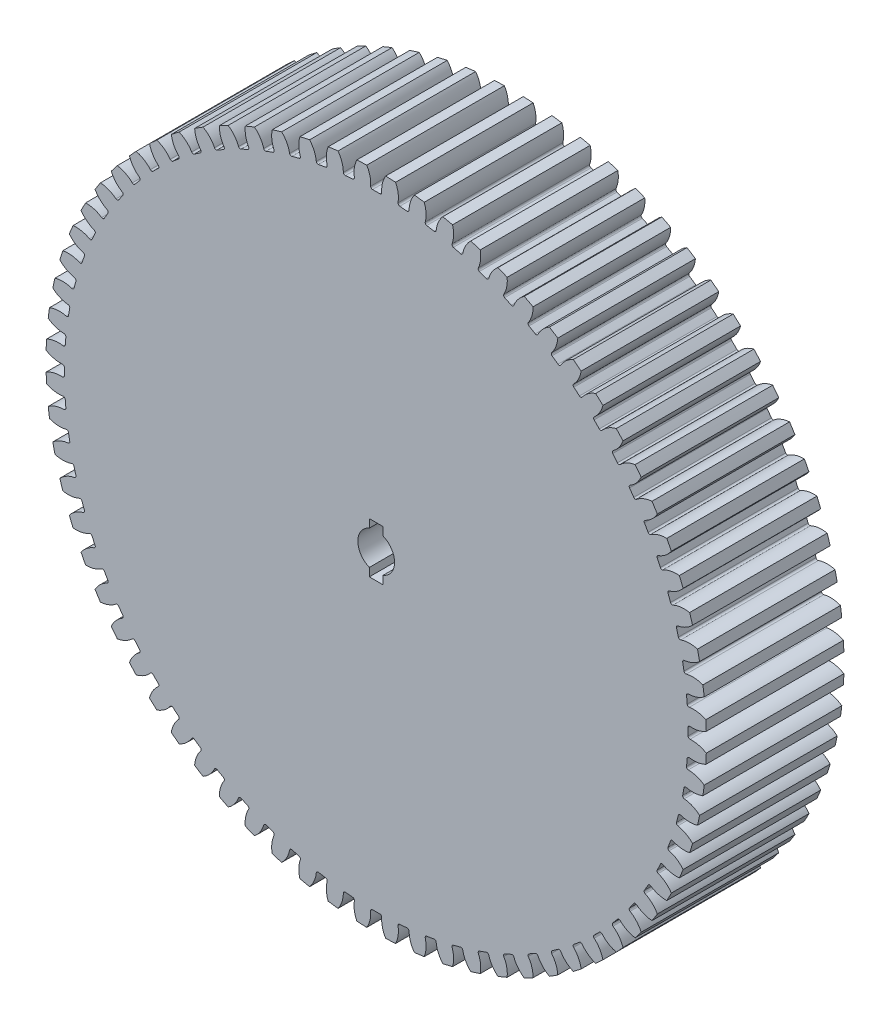
from build123d import *

# Parameters (mm, degrees)
SKETCH1_R           = 36
BOSS_EXTRUDE1_DEPTH = 7.5
SKETCH1_3_R         = 12
SKETCH1_3_R_2       = 4
CUT_EXTRUDE1_DEPTH  = 11
CUT_EXTRUDE2_DEPTH  = 52.461150395
CIRPATTERN1_START   = -7.5
CIRPATTERN1_DEPTH   = 15


# Read off the part's stored shape, not the designer's step: CirPattern1
with BuildPart() as part:
    # Sketch1 → Boss-Extrude1 (new, symmetric)
    with BuildSketch(Plane.XY):
        Circle(SKETCH1_R)
        with BuildLine():
            Line((0.75, -1.854049622), (0.75, -2.75))
            Line((0.75, -2.75), (-0.75, -2.75))
            Line((-0.75, -2.75), (-0.75, -1.854049622))
            ThreePointArc((-0.75, -1.854049622), (-2, 0), (-0.75, 1.854049622))
            Line((-0.75, 1.854049622), (-0.75, 2.75))
            Line((-0.75, 2.75), (0.75, 2.75))
            Line((0.75, 2.75), (0.75, 1.854049622))
            ThreePointArc((0.75, 1.854049622), (2, 0), (0.75, -1.854049622))
        make_face(mode=Mode.SUBTRACT)
    extrude(amount=BOSS_EXTRUDE1_DEPTH, both=True)

    # Sketch1<3> → Cut-Extrude1 (cut)
    with BuildSketch(Plane.XY):
        Circle(SKETCH1_3_R)
        Circle(SKETCH1_3_R_2, mode=Mode.SUBTRACT)
    extrude(amount=-CUT_EXTRUDE1_DEPTH, mode=Mode.SUBTRACT)

    # Sketch2 → Cut-Extrude2 (cut, symmetric)
    with BuildSketch(Plane.XY):
        with BuildLine():
            ThreePointArc((-0.4, 33.997646977), (0, 34), (0.4, 33.997646977))
            ThreePointArc((0.4, 33.997646977), (0.548013734, 34.060582294), (0.601825285, 34.212151541))
            ThreePointArc((0.601825285, 34.212151541), (1.569426683, 36.64385298), (4.077755677, 37.39065283))
            ThreePointArc((4.077755677, 37.39065283), (0, 38.661534345), (-4.077755677, 37.39065283))
            ThreePointArc((-4.077755677, 37.39065283), (-1.569426683, 36.64385298), (-0.601825285, 34.212151541))
            ThreePointArc((-0.601825285, 34.212151541), (-0.548013734, 34.060582294), (-0.4, 33.997646977))
        make_face()
    extrude(amount=CUT_EXTRUDE2_DEPTH, both=True, mode=Mode.SUBTRACT)

    # CirPattern1 outline → CirPattern1 (cut)
    with BuildSketch(Plane.XY.offset(CIRPATTERN1_START)):
        with BuildLine():
            ThreePointArc((3.581320637, 34.029511446), (3.736578294, 34.93923406), (4.161013155, 35.75871879))
            ThreePointArc((4.161013155, 35.75871879), (3.137606739, 35.863009132), (2.111638338, 35.938015855))
            ThreePointArc((2.111638338, 35.938015855), (2.38732305, 35.057278598), (2.382250321, 34.134416505))
            ThreePointArc((2.382250321, 34.134416505), (2.422646972, 33.978734039), (2.564612295, 33.903137964))
            ThreePointArc((2.564612295, 33.903137964), (2.963295253, 33.870619735), (3.361568053, 33.833413369))
            ThreePointArc((3.361568053, 33.833413369), (3.514503725, 33.883208951), (3.581320637, 34.029511446))
        make_face()
        with BuildLine():
            ThreePointArc((6.533559976, 33.587886221), (6.767514381, 34.480615469), (7.26175694, 35.259989877))
            ThreePointArc((7.26175694, 35.259989877), (6.251334396, 35.453079109), (5.235807381, 35.617219447))
            ThreePointArc((5.235807381, 35.617219447), (5.43368172, 34.715806155), (5.348195563, 33.796897949))
            ThreePointArc((5.348195563, 33.796897949), (5.374869871, 33.638287102), (5.509706341, 33.550605599))
            ThreePointArc((5.509706341, 33.550605599), (5.904038041, 33.483463602), (6.297552544, 33.411687056))
            ThreePointArc((6.297552544, 33.411687056), (6.45424622, 33.447963929), (6.533559976, 33.587886221))
        make_face()
        with BuildLine():
            ThreePointArc((9.436074978, 32.890636901), (9.746945597, 33.759578575), (10.307234369, 34.492911151))
            ThreePointArc((10.307234369, 34.492911151), (9.317485624, 34.773329747), (8.320128769, 35.025354492))
            ThreePointArc((8.320128769, 35.025354492), (8.438686791, 34.110125466), (8.273437807, 33.202164592))
            ThreePointArc((8.273437807, 33.202164592), (8.286186766, 33.041832488), (8.412868196, 32.942732867))
            ThreePointArc((8.412868196, 32.942732867), (8.799847534, 32.841478094), (9.185608857, 32.73567763))
            ThreePointArc((9.185608857, 32.73567763), (9.344868004, 32.758159705), (9.436074978, 32.890636901))
        make_face()
        with BuildLine():
            ThreePointArc((12.266775753, 31.943069974), (12.652196672, 32.781610903), (13.274267522, 33.463320543))
            ThreePointArc((13.274267522, 33.463320543), (12.31272516, 33.828934349), (11.341128952, 34.166925441))
            ThreePointArc((11.341128952, 34.166925441), (11.37946836, 33.244846125), (11.135714194, 32.354742715))
            ThreePointArc((11.135714194, 32.354742715), (11.134440776, 32.193909577), (11.252003044, 32.084146046))
            ThreePointArc((11.252003044, 32.084146046), (11.628684873, 31.949549107), (12.00375714, 31.810529931))
            ThreePointArc((12.00375714, 31.810529931), (12.1643697, 31.819046105), (12.266775753, 31.943069974))
        make_face()
        with BuildLine():
            ThreePointArc((15.004118957, 30.752396997), (15.461156891, 31.554155378), (16.140275483, 32.17905386))
            ThreePointArc((16.140275483, 32.17905386), (15.214257423, 32.627080334), (14.275816297, 33.048465457))
            ThreePointArc((14.275816297, 33.048465457), (14.233645304, 32.126553432), (13.913241073, 31.261081709))
            ThreePointArc((13.913241073, 31.261081709), (13.897954968, 31.100971576), (14.005503354, 30.981379501))
            ThreePointArc((14.005503354, 30.981379501), (14.369020899, 30.814464759), (14.730549584, 30.643284892))
            ThreePointArc((14.730549584, 30.643284892), (14.891293198, 30.637770352), (15.004118957, 30.752396997))
        make_face()
        with BuildLine():
            ThreePointArc((17.627271756, 29.32767971), (18.15244837, 30.086553678), (18.883446202, 30.649885147))
            ThreePointArc((18.883446202, 30.649885147), (18.000000001, 31.176914536), (17.10185606, 31.678486696))
            ThreePointArc((17.10185606, 31.678486696), (16.979495613, 30.763758268), (16.584879785, 29.929504995))
            ThreePointArc((16.584879785, 29.929504995), (16.555697331, 29.771336401), (16.652413327, 29.642825951))
            ThreePointArc((16.652413327, 29.642825951), (17, 29.444863729), (17.34523365, 29.242825951))
            ThreePointArc((17.34523365, 29.242825951), (17.504884963, 29.223322667), (17.627271756, 29.32767971))
        make_face()
        with BuildLine():
            ThreePointArc((20.116270373, 27.679761072), (20.705588755, 28.389975138), (21.482902493, 28.887452301))
            ThreePointArc((21.482902493, 28.887452301), (20.648751709, 29.489473595), (19.797740371, 30.067415523))
            ThreePointArc((19.797740371, 30.067415523), (19.596121708, 29.166832328), (19.130297548, 28.370146677))
            ThreePointArc((19.130297548, 28.370146677), (19.087440841, 28.215123381), (19.17258838, 28.078672597))
            ThreePointArc((19.17258838, 28.078672597), (19.501598836, 27.851169506), (19.827910015, 27.619811448))
            ThreePointArc((19.827910015, 27.619811448), (19.985253983, 27.586467851), (20.116270373, 27.679761072))
        make_face()
        with BuildLine():
            ThreePointArc((22.452172027, 25.821182739), (23.101147109, 26.477331744), (23.918860925, 26.905168501))
            ThreePointArc((23.918860925, 26.905168501), (23.140353949, 27.577599953), (22.342951924, 28.227513162))
            ThreePointArc((22.342951924, 28.227513162), (22.063609483, 27.347929183), (21.530122196, 26.594874412))
            ThreePointArc((21.530122196, 26.594874412), (21.473917401, 26.444176234), (21.546848458, 26.30082359))
            ThreePointArc((21.546848458, 26.30082359), (21.854778729, 26.045511066), (22.159684013, 25.786593502))
            ThreePointArc((22.159684013, 25.786593502), (22.313523154, 25.739663357), (22.452172027, 25.821182739))
        make_face()
        with BuildLine():
            ThreePointArc((24.617199094, 23.766089614), (25.320891784, 24.363179869), (26.172782382, 24.718120122))
            ThreePointArc((26.172782382, 24.718120122), (25.455844123, 25.455844123), (24.718120122, 26.172782382))
            ThreePointArc((24.718120122, 26.172782382), (24.363179869, 25.320891784), (23.766089614, 24.617199094))
            ThreePointArc((23.766089614, 24.617199094), (23.696964483, 24.471972939), (23.75712401, 24.322809435))
            ThreePointArc((23.75712401, 24.322809435), (24.04163056, 24.04163056), (24.322809435, 23.75712401))
            ThreePointArc((24.322809435, 23.75712401), (24.471972939, 23.696964483), (24.617199094, 23.766089614))
        make_face()
        with BuildLine():
            ThreePointArc((26.594874412, 21.530122196), (27.347929183, 22.063609483), (28.227513162, 22.342951924))
            ThreePointArc((28.227513162, 22.342951924), (27.577599953, 23.140353949), (26.905168501, 23.918860925))
            ThreePointArc((26.905168501, 23.918860925), (26.477331744, 23.101147109), (25.821182739, 22.452172027))
            ThreePointArc((25.821182739, 22.452172027), (25.739663357, 22.313523154), (25.786593502, 22.159684013))
            ThreePointArc((25.786593502, 22.159684013), (26.045511066, 21.854778729), (26.30082359, 21.546848458))
            ThreePointArc((26.30082359, 21.546848458), (26.444176234, 21.473917401), (26.594874412, 21.530122196))
        make_face()
        with BuildLine():
            ThreePointArc((28.370146677, 19.130297548), (29.166832328, 19.596121708), (30.067415522, 19.797740371))
            ThreePointArc((30.067415522, 19.797740371), (29.489473595, 20.648751709), (28.887452302, 21.482902493))
            ThreePointArc((28.887452302, 21.482902493), (28.389975138, 20.705588755), (27.679761072, 20.116270373))
            ThreePointArc((27.679761072, 20.116270373), (27.586467851, 19.985253983), (27.619811448, 19.827910015))
            ThreePointArc((27.619811448, 19.827910015), (27.851169506, 19.501598836), (28.078672597, 19.17258838))
            ThreePointArc((28.078672597, 19.17258838), (28.215123381, 19.087440841), (28.370146677, 19.130297548))
        make_face()
        with BuildLine():
            ThreePointArc((29.929504995, 16.584879785), (30.763758268, 16.979495613), (31.678486695, 17.10185606))
            ThreePointArc((31.678486695, 17.10185606), (31.176914536, 18), (30.649885147, 18.883446202))
            ThreePointArc((30.649885147, 18.883446202), (30.086553678, 18.15244837), (29.32767971, 17.627271756))
            ThreePointArc((29.32767971, 17.627271756), (29.223322667, 17.504884963), (29.242825951, 17.34523365))
            ThreePointArc((29.242825951, 17.34523365), (29.444863729, 17), (29.642825951, 16.652413327))
            ThreePointArc((29.642825951, 16.652413327), (29.771336401, 16.555697331), (29.929504995, 16.584879785))
        make_face()
        with BuildLine():
            ThreePointArc((31.261081709, 13.913241073), (32.126553432, 14.233645304), (33.048465457, 14.275816297))
            ThreePointArc((33.048465457, 14.275816297), (32.627080334, 15.214257423), (32.17905386, 16.140275483))
            ThreePointArc((32.17905386, 16.140275483), (31.554155378, 15.461156891), (30.752396997, 15.004118957))
            ThreePointArc((30.752396997, 15.004118957), (30.637770352, 14.891293198), (30.643284892, 14.730549584))
            ThreePointArc((30.643284892, 14.730549584), (30.814464759, 14.369020899), (30.981379501, 14.005503354))
            ThreePointArc((30.981379501, 14.005503354), (31.100971576, 13.897954968), (31.261081709, 13.913241073))
        make_face()
        with BuildLine():
            ThreePointArc((32.354742715, 11.135714194), (33.244846125, 11.37946836), (34.166925441, 11.341128952))
            ThreePointArc((34.166925441, 11.341128952), (33.828934349, 12.31272516), (33.463320543, 13.274267522))
            ThreePointArc((33.463320543, 13.274267522), (32.781610903, 12.652196672), (31.943069974, 12.266775753))
            ThreePointArc((31.943069974, 12.266775753), (31.819046105, 12.1643697), (31.810529931, 12.00375714))
            ThreePointArc((31.810529931, 12.00375714), (31.949549107, 11.628684873), (32.084146046, 11.252003044))
            ThreePointArc((32.084146046, 11.252003044), (32.193909577, 11.134440776), (32.354742715, 11.135714194))
        make_face()
        with BuildLine():
            ThreePointArc((33.202164592, 8.273437807), (34.110125466, 8.438686791), (35.025354492, 8.320128769))
            ThreePointArc((35.025354492, 8.320128769), (34.773329747, 9.317485624), (34.492911151, 10.307234369))
            ThreePointArc((34.492911151, 10.307234369), (33.759578575, 9.746945597), (32.890636901, 9.436074978))
            ThreePointArc((32.890636901, 9.436074978), (32.758159705, 9.344868004), (32.73567763, 9.185608857))
            ThreePointArc((32.73567763, 9.185608857), (32.841478094, 8.799847534), (32.942732867, 8.412868196))
            ThreePointArc((32.942732867, 8.412868196), (33.041832488, 8.286186766), (33.202164592, 8.273437807))
        make_face()
        with BuildLine():
            ThreePointArc((33.796897949, 5.348195563), (34.715806155, 5.43368172), (35.617219446, 5.235807381))
            ThreePointArc((35.617219446, 5.235807381), (35.453079109, 6.251334396), (35.259989878, 7.26175694))
            ThreePointArc((35.259989878, 7.26175694), (34.480615469, 6.767514381), (33.587886221, 6.533559976))
            ThreePointArc((33.587886221, 6.533559976), (33.447963929, 6.45424622), (33.411687056, 6.297552544))
            ThreePointArc((33.411687056, 6.297552544), (33.483463602, 5.904038041), (33.550605599, 5.509706341))
            ThreePointArc((33.550605599, 5.509706341), (33.638287102, 5.374869871), (33.796897949, 5.348195563))
        make_face()
        with BuildLine():
            ThreePointArc((34.134416505, 2.382250321), (35.057278598, 2.38732305), (35.938015854, 2.111638338))
            ThreePointArc((35.938015854, 2.111638338), (35.863009132, 3.137606739), (35.758718791, 4.161013155))
            ThreePointArc((35.758718791, 4.161013155), (34.93923406, 3.736578294), (34.029511446, 3.581320637))
            ThreePointArc((34.029511446, 3.581320637), (33.883208951, 3.514503725), (33.833413369, 3.361568053))
            ThreePointArc((33.833413369, 3.361568053), (33.870619735, 2.963295253), (33.903137964, 2.564612295))
            ThreePointArc((33.903137964, 2.564612295), (33.978734039, 2.422646972), (34.134416505, 2.382250321))
        make_face()
        with BuildLine():
            ThreePointArc((34.212151541, -0.601825285), (35.131943983, -0.67720459), (35.985302262, -1.028601548))
            ThreePointArc((35.985302262, -1.028601548), (36, 0), (35.985302262, 1.028601548))
            ThreePointArc((35.985302262, 1.028601548), (35.131943983, 0.67720459), (34.212151541, 0.601825285))
            ThreePointArc((34.212151541, 0.601825285), (34.060582294, 0.548013734), (33.997646977, 0.4))
            ThreePointArc((33.997646977, 0.4), (34, 0), (33.997646977, -0.4))
            ThreePointArc((33.997646977, -0.4), (34.060582294, -0.548013734), (34.212151541, -0.601825285))
        make_face()
        with BuildLine():
            ThreePointArc((34.029511446, -3.581320637), (34.93923406, -3.736578294), (35.75871879, -4.161013155))
            ThreePointArc((35.75871879, -4.161013155), (35.863009132, -3.137606739), (35.938015854, -2.111638338))
            ThreePointArc((35.938015854, -2.111638338), (35.057278598, -2.38732305), (34.134416505, -2.382250321))
            ThreePointArc((34.134416505, -2.382250321), (33.978734039, -2.422646972), (33.903137964, -2.564612295))
            ThreePointArc((33.903137964, -2.564612295), (33.870619735, -2.963295253), (33.833413369, -3.361568053))
            ThreePointArc((33.833413369, -3.361568053), (33.883208951, -3.514503725), (34.029511446, -3.581320637))
        make_face()
        with BuildLine():
            ThreePointArc((33.587886221, -6.533559976), (34.480615469, -6.767514381), (35.259989877, -7.26175694))
            ThreePointArc((35.259989877, -7.26175694), (35.453079109, -6.251334396), (35.617219446, -5.235807381))
            ThreePointArc((35.617219446, -5.235807381), (34.715806155, -5.43368172), (33.796897949, -5.348195563))
            ThreePointArc((33.796897949, -5.348195563), (33.638287102, -5.374869871), (33.550605599, -5.509706341))
            ThreePointArc((33.550605599, -5.509706341), (33.483463602, -5.904038041), (33.411687056, -6.297552544))
            ThreePointArc((33.411687056, -6.297552544), (33.447963929, -6.45424622), (33.587886221, -6.533559976))
        make_face()
        with BuildLine():
            ThreePointArc((32.890636901, -9.436074978), (33.759578575, -9.746945597), (34.492911151, -10.307234369))
            ThreePointArc((34.492911151, -10.307234369), (34.773329747, -9.317485624), (35.025354492, -8.320128769))
            ThreePointArc((35.025354492, -8.320128769), (34.110125466, -8.438686791), (33.202164592, -8.273437807))
            ThreePointArc((33.202164592, -8.273437807), (33.041832488, -8.286186766), (32.942732867, -8.412868196))
            ThreePointArc((32.942732867, -8.412868196), (32.841478094, -8.799847534), (32.73567763, -9.185608857))
            ThreePointArc((32.73567763, -9.185608857), (32.758159705, -9.344868004), (32.890636901, -9.436074978))
        make_face()
        with BuildLine():
            ThreePointArc((31.943069974, -12.266775753), (32.781610903, -12.652196672), (33.463320543, -13.274267522))
            ThreePointArc((33.463320543, -13.274267522), (33.828934348, -12.31272516), (34.166925441, -11.341128952))
            ThreePointArc((34.166925441, -11.341128952), (33.244846125, -11.37946836), (32.354742715, -11.135714194))
            ThreePointArc((32.354742715, -11.135714194), (32.193909577, -11.134440776), (32.084146046, -11.252003044))
            ThreePointArc((32.084146046, -11.252003044), (31.949549107, -11.628684873), (31.810529931, -12.00375714))
            ThreePointArc((31.810529931, -12.00375714), (31.819046105, -12.1643697), (31.943069974, -12.266775753))
        make_face()
        with BuildLine():
            ThreePointArc((30.752396997, -15.004118957), (31.554155378, -15.461156891), (32.17905386, -16.140275483))
            ThreePointArc((32.17905386, -16.140275483), (32.627080333, -15.214257423), (33.048465457, -14.275816297))
            ThreePointArc((33.048465457, -14.275816297), (32.126553432, -14.233645304), (31.261081709, -13.913241073))
            ThreePointArc((31.261081709, -13.913241073), (31.100971576, -13.897954968), (30.981379501, -14.005503354))
            ThreePointArc((30.981379501, -14.005503354), (30.814464759, -14.369020899), (30.643284892, -14.730549584))
            ThreePointArc((30.643284892, -14.730549584), (30.637770352, -14.891293198), (30.752396997, -15.004118957))
        make_face()
        with BuildLine():
            ThreePointArc((29.32767971, -17.627271756), (30.086553678, -18.15244837), (30.649885147, -18.883446202))
            ThreePointArc((30.649885147, -18.883446202), (31.176914536, -18), (31.678486695, -17.10185606))
            ThreePointArc((31.678486695, -17.10185606), (30.763758268, -16.979495613), (29.929504995, -16.584879785))
            ThreePointArc((29.929504995, -16.584879785), (29.771336401, -16.555697331), (29.642825951, -16.652413327))
            ThreePointArc((29.642825951, -16.652413327), (29.444863729, -17), (29.242825951, -17.34523365))
            ThreePointArc((29.242825951, -17.34523365), (29.223322667, -17.504884963), (29.32767971, -17.627271756))
        make_face()
        with BuildLine():
            ThreePointArc((27.679761072, -20.116270373), (28.389975138, -20.705588755), (28.887452301, -21.482902493))
            ThreePointArc((28.887452301, -21.482902493), (29.489473594, -20.648751709), (30.067415522, -19.797740371))
            ThreePointArc((30.067415522, -19.797740371), (29.166832328, -19.596121708), (28.370146677, -19.130297548))
            ThreePointArc((28.370146677, -19.130297548), (28.215123381, -19.087440841), (28.078672597, -19.17258838))
            ThreePointArc((28.078672597, -19.17258838), (27.851169506, -19.501598836), (27.619811448, -19.827910015))
            ThreePointArc((27.619811448, -19.827910015), (27.586467851, -19.985253983), (27.679761072, -20.116270373))
        make_face()
        with BuildLine():
            ThreePointArc((25.821182739, -22.452172027), (26.477331744, -23.101147109), (26.905168501, -23.918860925))
            ThreePointArc((26.905168501, -23.918860925), (27.577599952, -23.140353949), (28.227513162, -22.342951924))
            ThreePointArc((28.227513162, -22.342951924), (27.347929183, -22.063609483), (26.594874412, -21.530122196))
            ThreePointArc((26.594874412, -21.530122196), (26.444176234, -21.473917401), (26.30082359, -21.546848458))
            ThreePointArc((26.30082359, -21.546848458), (26.045511066, -21.854778729), (25.786593502, -22.159684013))
            ThreePointArc((25.786593502, -22.159684013), (25.739663357, -22.313523154), (25.821182739, -22.452172027))
        make_face()
        with BuildLine():
            ThreePointArc((23.766089614, -24.617199094), (24.363179869, -25.320891784), (24.718120122, -26.172782382))
            ThreePointArc((24.718120122, -26.172782382), (25.455844123, -25.455844123), (26.172782382, -24.718120122))
            ThreePointArc((26.172782382, -24.718120122), (25.320891784, -24.363179869), (24.617199094, -23.766089614))
            ThreePointArc((24.617199094, -23.766089614), (24.471972939, -23.696964483), (24.322809435, -23.75712401))
            ThreePointArc((24.322809435, -23.75712401), (24.04163056, -24.04163056), (23.75712401, -24.322809435))
            ThreePointArc((23.75712401, -24.322809435), (23.696964483, -24.471972939), (23.766089614, -24.617199094))
        make_face()
        with BuildLine():
            ThreePointArc((21.530122196, -26.594874412), (22.063609483, -27.347929183), (22.342951924, -28.227513162))
            ThreePointArc((22.342951924, -28.227513162), (23.140353949, -27.577599952), (23.918860925, -26.905168501))
            ThreePointArc((23.918860925, -26.905168501), (23.101147109, -26.477331744), (22.452172027, -25.821182739))
            ThreePointArc((22.452172027, -25.821182739), (22.313523154, -25.739663357), (22.159684013, -25.786593502))
            ThreePointArc((22.159684013, -25.786593502), (21.854778729, -26.045511066), (21.546848458, -26.30082359))
            ThreePointArc((21.546848458, -26.30082359), (21.473917401, -26.444176234), (21.530122196, -26.594874412))
        make_face()
        with BuildLine():
            ThreePointArc((19.130297548, -28.370146677), (19.596121707, -29.166832328), (19.797740371, -30.067415522))
            ThreePointArc((19.797740371, -30.067415522), (20.648751709, -29.489473594), (21.482902493, -28.887452301))
            ThreePointArc((21.482902493, -28.887452301), (20.705588755, -28.389975138), (20.116270373, -27.679761072))
            ThreePointArc((20.116270373, -27.679761072), (19.985253983, -27.586467851), (19.827910015, -27.619811448))
            ThreePointArc((19.827910015, -27.619811448), (19.501598836, -27.851169506), (19.17258838, -28.078672597))
            ThreePointArc((19.17258838, -28.078672597), (19.087440841, -28.215123381), (19.130297548, -28.370146677))
        make_face()
        with BuildLine():
            ThreePointArc((16.584879785, -29.929504995), (16.979495613, -30.763758268), (17.10185606, -31.678486695))
            ThreePointArc((17.10185606, -31.678486695), (18, -31.176914536), (18.883446202, -30.649885147))
            ThreePointArc((18.883446202, -30.649885147), (18.15244837, -30.086553678), (17.627271756, -29.32767971))
            ThreePointArc((17.627271756, -29.32767971), (17.504884963, -29.223322667), (17.34523365, -29.242825951))
            ThreePointArc((17.34523365, -29.242825951), (17, -29.444863729), (16.652413327, -29.642825951))
            ThreePointArc((16.652413327, -29.642825951), (16.555697331, -29.771336401), (16.584879785, -29.929504995))
        make_face()
        with BuildLine():
            ThreePointArc((13.913241073, -31.261081709), (14.233645304, -32.126553432), (14.275816297, -33.048465457))
            ThreePointArc((14.275816297, -33.048465457), (15.214257423, -32.627080333), (16.140275483, -32.17905386))
            ThreePointArc((16.140275483, -32.17905386), (15.461156891, -31.554155378), (15.004118957, -30.752396997))
            ThreePointArc((15.004118957, -30.752396997), (14.891293198, -30.637770352), (14.730549584, -30.643284892))
            ThreePointArc((14.730549584, -30.643284892), (14.369020899, -30.814464759), (14.005503354, -30.981379501))
            ThreePointArc((14.005503354, -30.981379501), (13.897954968, -31.100971576), (13.913241073, -31.261081709))
        make_face()
        with BuildLine():
            ThreePointArc((11.135714194, -32.354742715), (11.37946836, -33.244846125), (11.341128952, -34.166925441))
            ThreePointArc((11.341128952, -34.166925441), (12.31272516, -33.828934348), (13.274267522, -33.463320543))
            ThreePointArc((13.274267522, -33.463320543), (12.652196672, -32.781610903), (12.266775753, -31.943069974))
            ThreePointArc((12.266775753, -31.943069974), (12.1643697, -31.819046105), (12.00375714, -31.810529931))
            ThreePointArc((12.00375714, -31.810529931), (11.628684873, -31.949549107), (11.252003044, -32.084146046))
            ThreePointArc((11.252003044, -32.084146046), (11.134440776, -32.193909577), (11.135714194, -32.354742715))
        make_face()
        with BuildLine():
            ThreePointArc((-2.111638338, 35.938015855), (-3.137606739, 35.863009132), (-4.161013155, 35.758718791))
            ThreePointArc((-4.161013155, 35.758718791), (-3.736578294, 34.93923406), (-3.581320637, 34.029511446))
            ThreePointArc((-3.581320637, 34.029511446), (-3.514503725, 33.883208951), (-3.361568053, 33.833413369))
            ThreePointArc((-3.361568053, 33.833413369), (-2.963295253, 33.870619735), (-2.564612295, 33.903137964))
            ThreePointArc((-2.564612295, 33.903137964), (-2.422646972, 33.978734039), (-2.382250321, 34.134416505))
            ThreePointArc((-2.382250321, 34.134416505), (-2.38732305, 35.057278598), (-2.111638338, 35.938015855))
        make_face()
        with BuildLine():
            ThreePointArc((-5.235807381, 35.617219447), (-6.251334396, 35.453079109), (-7.26175694, 35.259989878))
            ThreePointArc((-7.26175694, 35.259989878), (-6.767514381, 34.480615469), (-6.533559976, 33.587886221))
            ThreePointArc((-6.533559976, 33.587886221), (-6.45424622, 33.447963929), (-6.297552544, 33.411687056))
            ThreePointArc((-6.297552544, 33.411687056), (-5.904038041, 33.483463602), (-5.509706341, 33.550605599))
            ThreePointArc((-5.509706341, 33.550605599), (-5.374869871, 33.638287102), (-5.348195563, 33.796897949))
            ThreePointArc((-5.348195563, 33.796897949), (-5.43368172, 34.715806155), (-5.235807381, 35.617219447))
        make_face()
        with BuildLine():
            ThreePointArc((-8.320128769, 35.025354492), (-9.317485624, 34.773329747), (-10.307234369, 34.492911151))
            ThreePointArc((-10.307234369, 34.492911151), (-9.746945597, 33.759578575), (-9.436074978, 32.890636901))
            ThreePointArc((-9.436074978, 32.890636901), (-9.344868004, 32.758159705), (-9.185608857, 32.73567763))
            ThreePointArc((-9.185608857, 32.73567763), (-8.799847534, 32.841478094), (-8.412868196, 32.942732867))
            ThreePointArc((-8.412868196, 32.942732867), (-8.286186766, 33.041832488), (-8.273437807, 33.202164592))
            ThreePointArc((-8.273437807, 33.202164592), (-8.438686791, 34.110125466), (-8.320128769, 35.025354492))
        make_face()
        with BuildLine():
            ThreePointArc((-11.341128952, 34.166925441), (-12.31272516, 33.828934349), (-13.274267522, 33.463320543))
            ThreePointArc((-13.274267522, 33.463320543), (-12.652196672, 32.781610903), (-12.266775753, 31.943069974))
            ThreePointArc((-12.266775753, 31.943069974), (-12.1643697, 31.819046105), (-12.00375714, 31.810529931))
            ThreePointArc((-12.00375714, 31.810529931), (-11.628684873, 31.949549107), (-11.252003044, 32.084146046))
            ThreePointArc((-11.252003044, 32.084146046), (-11.134440776, 32.193909577), (-11.135714194, 32.354742715))
            ThreePointArc((-11.135714194, 32.354742715), (-11.37946836, 33.244846125), (-11.341128952, 34.166925441))
        make_face()
        with BuildLine():
            ThreePointArc((-14.275816297, 33.048465457), (-15.214257423, 32.627080334), (-16.140275483, 32.17905386))
            ThreePointArc((-16.140275483, 32.17905386), (-15.461156891, 31.554155378), (-15.004118957, 30.752396997))
            ThreePointArc((-15.004118957, 30.752396997), (-14.891293198, 30.637770352), (-14.730549584, 30.643284892))
            ThreePointArc((-14.730549584, 30.643284892), (-14.369020899, 30.814464759), (-14.005503354, 30.981379501))
            ThreePointArc((-14.005503354, 30.981379501), (-13.897954968, 31.100971576), (-13.913241073, 31.261081709))
            ThreePointArc((-13.913241073, 31.261081709), (-14.233645304, 32.126553432), (-14.275816297, 33.048465457))
        make_face()
        with BuildLine():
            ThreePointArc((-17.10185606, 31.678486696), (-18.000000001, 31.176914536), (-18.883446202, 30.649885147))
            ThreePointArc((-18.883446202, 30.649885147), (-18.15244837, 30.086553678), (-17.627271756, 29.32767971))
            ThreePointArc((-17.627271756, 29.32767971), (-17.504884963, 29.223322667), (-17.34523365, 29.242825951))
            ThreePointArc((-17.34523365, 29.242825951), (-17, 29.444863729), (-16.652413327, 29.642825951))
            ThreePointArc((-16.652413327, 29.642825951), (-16.555697331, 29.771336401), (-16.584879785, 29.929504995))
            ThreePointArc((-16.584879785, 29.929504995), (-16.979495613, 30.763758268), (-17.10185606, 31.678486696))
        make_face()
        with BuildLine():
            ThreePointArc((-19.797740371, 30.067415523), (-20.648751709, 29.489473595), (-21.482902494, 28.887452302))
            ThreePointArc((-21.482902494, 28.887452302), (-20.705588755, 28.389975138), (-20.116270373, 27.679761072))
            ThreePointArc((-20.116270373, 27.679761072), (-19.985253983, 27.586467851), (-19.827910015, 27.619811448))
            ThreePointArc((-19.827910015, 27.619811448), (-19.501598836, 27.851169506), (-19.17258838, 28.078672597))
            ThreePointArc((-19.17258838, 28.078672597), (-19.087440841, 28.215123381), (-19.130297548, 28.370146677))
            ThreePointArc((-19.130297548, 28.370146677), (-19.596121708, 29.166832328), (-19.797740371, 30.067415523))
        make_face()
        with BuildLine():
            ThreePointArc((-22.342951924, 28.227513162), (-23.140353949, 27.577599953), (-23.918860925, 26.905168501))
            ThreePointArc((-23.918860925, 26.905168501), (-23.101147109, 26.477331744), (-22.452172027, 25.821182739))
            ThreePointArc((-22.452172027, 25.821182739), (-22.313523154, 25.739663357), (-22.159684013, 25.786593502))
            ThreePointArc((-22.159684013, 25.786593502), (-21.854778729, 26.045511066), (-21.546848458, 26.30082359))
            ThreePointArc((-21.546848458, 26.30082359), (-21.473917401, 26.444176234), (-21.530122196, 26.594874412))
            ThreePointArc((-21.530122196, 26.594874412), (-22.063609483, 27.347929183), (-22.342951924, 28.227513162))
        make_face()
        with BuildLine():
            ThreePointArc((-24.718120122, 26.172782382), (-25.455844123, 25.455844123), (-26.172782382, 24.718120122))
            ThreePointArc((-26.172782382, 24.718120122), (-25.320891784, 24.363179869), (-24.617199094, 23.766089614))
            ThreePointArc((-24.617199094, 23.766089614), (-24.471972939, 23.696964483), (-24.322809435, 23.75712401))
            ThreePointArc((-24.322809435, 23.75712401), (-24.04163056, 24.04163056), (-23.75712401, 24.322809435))
            ThreePointArc((-23.75712401, 24.322809435), (-23.696964483, 24.471972939), (-23.766089614, 24.617199094))
            ThreePointArc((-23.766089614, 24.617199094), (-24.363179869, 25.320891784), (-24.718120122, 26.172782382))
        make_face()
        with BuildLine():
            ThreePointArc((-26.905168501, 23.918860925), (-27.577599953, 23.140353949), (-28.227513162, 22.342951924))
            ThreePointArc((-28.227513162, 22.342951924), (-27.347929183, 22.063609483), (-26.594874412, 21.530122196))
            ThreePointArc((-26.594874412, 21.530122196), (-26.444176234, 21.473917401), (-26.30082359, 21.546848458))
            ThreePointArc((-26.30082359, 21.546848458), (-26.045511066, 21.854778729), (-25.786593502, 22.159684013))
            ThreePointArc((-25.786593502, 22.159684013), (-25.739663357, 22.313523154), (-25.821182739, 22.452172027))
            ThreePointArc((-25.821182739, 22.452172027), (-26.477331744, 23.101147109), (-26.905168501, 23.918860925))
        make_face()
        with BuildLine():
            ThreePointArc((-28.887452302, 21.482902493), (-29.489473595, 20.648751709), (-30.067415523, 19.797740371))
            ThreePointArc((-30.067415523, 19.797740371), (-29.166832328, 19.596121708), (-28.370146677, 19.130297548))
            ThreePointArc((-28.370146677, 19.130297548), (-28.215123381, 19.087440841), (-28.078672597, 19.17258838))
            ThreePointArc((-28.078672597, 19.17258838), (-27.851169506, 19.501598836), (-27.619811448, 19.827910015))
            ThreePointArc((-27.619811448, 19.827910015), (-27.586467851, 19.985253983), (-27.679761072, 20.116270373))
            ThreePointArc((-27.679761072, 20.116270373), (-28.389975138, 20.705588755), (-28.887452302, 21.482902493))
        make_face()
        with BuildLine():
            ThreePointArc((-30.649885147, 18.883446202), (-31.176914536, 18), (-31.678486696, 17.10185606))
            ThreePointArc((-31.678486696, 17.10185606), (-30.763758268, 16.979495613), (-29.929504995, 16.584879785))
            ThreePointArc((-29.929504995, 16.584879785), (-29.771336401, 16.555697331), (-29.642825951, 16.652413327))
            ThreePointArc((-29.642825951, 16.652413327), (-29.444863729, 17), (-29.242825951, 17.34523365))
            ThreePointArc((-29.242825951, 17.34523365), (-29.223322667, 17.504884963), (-29.32767971, 17.627271756))
            ThreePointArc((-29.32767971, 17.627271756), (-30.086553678, 18.15244837), (-30.649885147, 18.883446202))
        make_face()
        with BuildLine():
            ThreePointArc((-32.17905386, 16.140275483), (-32.627080334, 15.214257423), (-33.048465457, 14.275816297))
            ThreePointArc((-33.048465457, 14.275816297), (-32.126553432, 14.233645304), (-31.261081709, 13.913241073))
            ThreePointArc((-31.261081709, 13.913241073), (-31.100971576, 13.897954968), (-30.981379501, 14.005503354))
            ThreePointArc((-30.981379501, 14.005503354), (-30.814464759, 14.369020899), (-30.643284892, 14.730549584))
            ThreePointArc((-30.643284892, 14.730549584), (-30.637770352, 14.891293198), (-30.752396997, 15.004118957))
            ThreePointArc((-30.752396997, 15.004118957), (-31.554155378, 15.461156891), (-32.17905386, 16.140275483))
        make_face()
        with BuildLine():
            ThreePointArc((-33.463320543, 13.274267522), (-33.828934349, 12.31272516), (-34.166925441, 11.341128952))
            ThreePointArc((-34.166925441, 11.341128952), (-33.244846125, 11.37946836), (-32.354742715, 11.135714194))
            ThreePointArc((-32.354742715, 11.135714194), (-32.193909577, 11.134440776), (-32.084146046, 11.252003044))
            ThreePointArc((-32.084146046, 11.252003044), (-31.949549107, 11.628684873), (-31.810529931, 12.00375714))
            ThreePointArc((-31.810529931, 12.00375714), (-31.819046105, 12.1643697), (-31.943069974, 12.266775753))
            ThreePointArc((-31.943069974, 12.266775753), (-32.781610903, 12.652196672), (-33.463320543, 13.274267522))
        make_face()
        with BuildLine():
            ThreePointArc((-34.492911151, 10.307234369), (-34.773329747, 9.317485624), (-35.025354492, 8.320128769))
            ThreePointArc((-35.025354492, 8.320128769), (-34.110125466, 8.438686791), (-33.202164592, 8.273437807))
            ThreePointArc((-33.202164592, 8.273437807), (-33.041832488, 8.286186766), (-32.942732867, 8.412868196))
            ThreePointArc((-32.942732867, 8.412868196), (-32.841478094, 8.799847534), (-32.73567763, 9.185608857))
            ThreePointArc((-32.73567763, 9.185608857), (-32.758159705, 9.344868004), (-32.890636901, 9.436074978))
            ThreePointArc((-32.890636901, 9.436074978), (-33.759578575, 9.746945597), (-34.492911151, 10.307234369))
        make_face()
        with BuildLine():
            ThreePointArc((-35.259989878, 7.26175694), (-35.453079109, 6.251334396), (-35.617219446, 5.235807381))
            ThreePointArc((-35.617219446, 5.235807381), (-34.715806155, 5.43368172), (-33.796897949, 5.348195563))
            ThreePointArc((-33.796897949, 5.348195563), (-33.638287102, 5.374869871), (-33.550605599, 5.509706341))
            ThreePointArc((-33.550605599, 5.509706341), (-33.483463602, 5.904038041), (-33.411687056, 6.297552544))
            ThreePointArc((-33.411687056, 6.297552544), (-33.447963929, 6.45424622), (-33.587886221, 6.533559976))
            ThreePointArc((-33.587886221, 6.533559976), (-34.480615469, 6.767514381), (-35.259989878, 7.26175694))
        make_face()
        with BuildLine():
            ThreePointArc((-35.758718791, 4.161013155), (-35.863009132, 3.137606739), (-35.938015854, 2.111638338))
            ThreePointArc((-35.938015854, 2.111638338), (-35.057278598, 2.38732305), (-34.134416505, 2.382250321))
            ThreePointArc((-34.134416505, 2.382250321), (-33.978734039, 2.422646972), (-33.903137964, 2.564612295))
            ThreePointArc((-33.903137964, 2.564612295), (-33.870619735, 2.963295253), (-33.833413369, 3.361568053))
            ThreePointArc((-33.833413369, 3.361568053), (-33.883208951, 3.514503725), (-34.029511446, 3.581320637))
            ThreePointArc((-34.029511446, 3.581320637), (-34.93923406, 3.736578294), (-35.758718791, 4.161013155))
        make_face()
        with BuildLine():
            ThreePointArc((-35.985302262, 1.028601548), (-36, 0), (-35.985302262, -1.028601548))
            ThreePointArc((-35.985302262, -1.028601548), (-35.131943983, -0.67720459), (-34.212151541, -0.601825285))
            ThreePointArc((-34.212151541, -0.601825285), (-34.060582294, -0.548013734), (-33.997646977, -0.4))
            ThreePointArc((-33.997646977, -0.4), (-34, 0), (-33.997646977, 0.4))
            ThreePointArc((-33.997646977, 0.4), (-34.060582294, 0.548013734), (-34.212151541, 0.601825285))
            ThreePointArc((-34.212151541, 0.601825285), (-35.131943983, 0.67720459), (-35.985302262, 1.028601548))
        make_face()
        with BuildLine():
            ThreePointArc((-35.938015854, -2.111638338), (-35.863009132, -3.137606739), (-35.75871879, -4.161013155))
            ThreePointArc((-35.75871879, -4.161013155), (-34.93923406, -3.736578294), (-34.029511446, -3.581320637))
            ThreePointArc((-34.029511446, -3.581320637), (-33.883208951, -3.514503725), (-33.833413369, -3.361568053))
            ThreePointArc((-33.833413369, -3.361568053), (-33.870619735, -2.963295253), (-33.903137964, -2.564612295))
            ThreePointArc((-33.903137964, -2.564612295), (-33.978734039, -2.422646972), (-34.134416505, -2.382250321))
            ThreePointArc((-34.134416505, -2.382250321), (-35.057278598, -2.38732305), (-35.938015854, -2.111638338))
        make_face()
        with BuildLine():
            ThreePointArc((-35.617219446, -5.235807381), (-35.453079109, -6.251334396), (-35.259989877, -7.26175694))
            ThreePointArc((-35.259989877, -7.26175694), (-34.480615469, -6.767514381), (-33.587886221, -6.533559976))
            ThreePointArc((-33.587886221, -6.533559976), (-33.447963929, -6.45424622), (-33.411687056, -6.297552544))
            ThreePointArc((-33.411687056, -6.297552544), (-33.483463602, -5.904038041), (-33.550605599, -5.509706341))
            ThreePointArc((-33.550605599, -5.509706341), (-33.638287102, -5.374869871), (-33.796897949, -5.348195563))
            ThreePointArc((-33.796897949, -5.348195563), (-34.715806155, -5.43368172), (-35.617219446, -5.235807381))
        make_face()
        with BuildLine():
            ThreePointArc((-35.025354492, -8.320128769), (-34.773329747, -9.317485624), (-34.492911151, -10.307234369))
            ThreePointArc((-34.492911151, -10.307234369), (-33.759578575, -9.746945597), (-32.890636901, -9.436074978))
            ThreePointArc((-32.890636901, -9.436074978), (-32.758159705, -9.344868004), (-32.73567763, -9.185608857))
            ThreePointArc((-32.73567763, -9.185608857), (-32.841478094, -8.799847534), (-32.942732867, -8.412868196))
            ThreePointArc((-32.942732867, -8.412868196), (-33.041832488, -8.286186766), (-33.202164592, -8.273437807))
            ThreePointArc((-33.202164592, -8.273437807), (-34.110125466, -8.438686791), (-35.025354492, -8.320128769))
        make_face()
        with BuildLine():
            ThreePointArc((-34.166925441, -11.341128952), (-33.828934348, -12.31272516), (-33.463320543, -13.274267522))
            ThreePointArc((-33.463320543, -13.274267522), (-32.781610903, -12.652196672), (-31.943069974, -12.266775753))
            ThreePointArc((-31.943069974, -12.266775753), (-31.819046105, -12.1643697), (-31.810529931, -12.00375714))
            ThreePointArc((-31.810529931, -12.00375714), (-31.949549107, -11.628684873), (-32.084146046, -11.252003044))
            ThreePointArc((-32.084146046, -11.252003044), (-32.193909577, -11.134440776), (-32.354742715, -11.135714194))
            ThreePointArc((-32.354742715, -11.135714194), (-33.244846125, -11.37946836), (-34.166925441, -11.341128952))
        make_face()
        with BuildLine():
            ThreePointArc((-33.048465457, -14.275816297), (-32.627080333, -15.214257423), (-32.17905386, -16.140275483))
            ThreePointArc((-32.17905386, -16.140275483), (-31.554155378, -15.461156891), (-30.752396997, -15.004118957))
            ThreePointArc((-30.752396997, -15.004118957), (-30.637770352, -14.891293198), (-30.643284892, -14.730549584))
            ThreePointArc((-30.643284892, -14.730549584), (-30.814464759, -14.369020899), (-30.981379501, -14.005503354))
            ThreePointArc((-30.981379501, -14.005503354), (-31.100971576, -13.897954968), (-31.261081709, -13.913241073))
            ThreePointArc((-31.261081709, -13.913241073), (-32.126553432, -14.233645304), (-33.048465457, -14.275816297))
        make_face()
        with BuildLine():
            ThreePointArc((-31.678486695, -17.10185606), (-31.176914536, -18), (-30.649885147, -18.883446202))
            ThreePointArc((-30.649885147, -18.883446202), (-30.086553678, -18.15244837), (-29.32767971, -17.627271756))
            ThreePointArc((-29.32767971, -17.627271756), (-29.223322667, -17.504884963), (-29.242825951, -17.34523365))
            ThreePointArc((-29.242825951, -17.34523365), (-29.444863729, -17), (-29.642825951, -16.652413327))
            ThreePointArc((-29.642825951, -16.652413327), (-29.771336401, -16.555697331), (-29.929504995, -16.584879785))
            ThreePointArc((-29.929504995, -16.584879785), (-30.763758268, -16.979495613), (-31.678486695, -17.10185606))
        make_face()
        with BuildLine():
            ThreePointArc((-30.067415522, -19.797740371), (-29.489473594, -20.648751709), (-28.887452301, -21.482902493))
            ThreePointArc((-28.887452301, -21.482902493), (-28.389975138, -20.705588755), (-27.679761072, -20.116270373))
            ThreePointArc((-27.679761072, -20.116270373), (-27.586467851, -19.985253983), (-27.619811448, -19.827910015))
            ThreePointArc((-27.619811448, -19.827910015), (-27.851169506, -19.501598836), (-28.078672597, -19.17258838))
            ThreePointArc((-28.078672597, -19.17258838), (-28.215123381, -19.087440841), (-28.370146677, -19.130297548))
            ThreePointArc((-28.370146677, -19.130297548), (-29.166832328, -19.596121707), (-30.067415522, -19.797740371))
        make_face()
        with BuildLine():
            ThreePointArc((-28.227513162, -22.342951924), (-27.577599952, -23.140353949), (-26.905168501, -23.918860925))
            ThreePointArc((-26.905168501, -23.918860925), (-26.477331744, -23.101147109), (-25.821182739, -22.452172027))
            ThreePointArc((-25.821182739, -22.452172027), (-25.739663357, -22.313523154), (-25.786593502, -22.159684013))
            ThreePointArc((-25.786593502, -22.159684013), (-26.045511066, -21.854778729), (-26.30082359, -21.546848458))
            ThreePointArc((-26.30082359, -21.546848458), (-26.444176234, -21.473917401), (-26.594874412, -21.530122196))
            ThreePointArc((-26.594874412, -21.530122196), (-27.347929183, -22.063609483), (-28.227513162, -22.342951924))
        make_face()
        with BuildLine():
            ThreePointArc((-26.172782382, -24.718120122), (-25.455844123, -25.455844123), (-24.718120122, -26.172782382))
            ThreePointArc((-24.718120122, -26.172782382), (-24.363179869, -25.320891784), (-23.766089614, -24.617199094))
            ThreePointArc((-23.766089614, -24.617199094), (-23.696964483, -24.471972939), (-23.75712401, -24.322809435))
            ThreePointArc((-23.75712401, -24.322809435), (-24.04163056, -24.04163056), (-24.322809435, -23.75712401))
            ThreePointArc((-24.322809435, -23.75712401), (-24.471972939, -23.696964483), (-24.617199094, -23.766089614))
            ThreePointArc((-24.617199094, -23.766089614), (-25.320891784, -24.363179869), (-26.172782382, -24.718120122))
        make_face()
        with BuildLine():
            ThreePointArc((-23.918860925, -26.905168501), (-23.140353949, -27.577599952), (-22.342951924, -28.227513162))
            ThreePointArc((-22.342951924, -28.227513162), (-22.063609483, -27.347929183), (-21.530122196, -26.594874412))
            ThreePointArc((-21.530122196, -26.594874412), (-21.473917401, -26.444176234), (-21.546848458, -26.30082359))
            ThreePointArc((-21.546848458, -26.30082359), (-21.854778729, -26.045511066), (-22.159684013, -25.786593502))
            ThreePointArc((-22.159684013, -25.786593502), (-22.313523154, -25.739663357), (-22.452172027, -25.821182739))
            ThreePointArc((-22.452172027, -25.821182739), (-23.101147109, -26.477331744), (-23.918860925, -26.905168501))
        make_face()
        with BuildLine():
            ThreePointArc((-21.482902493, -28.887452301), (-20.648751709, -29.489473594), (-19.797740371, -30.067415522))
            ThreePointArc((-19.797740371, -30.067415522), (-19.596121708, -29.166832328), (-19.130297548, -28.370146677))
            ThreePointArc((-19.130297548, -28.370146677), (-19.087440841, -28.215123381), (-19.17258838, -28.078672597))
            ThreePointArc((-19.17258838, -28.078672597), (-19.501598836, -27.851169506), (-19.827910015, -27.619811448))
            ThreePointArc((-19.827910015, -27.619811448), (-19.985253983, -27.586467851), (-20.116270373, -27.679761072))
            ThreePointArc((-20.116270373, -27.679761072), (-20.705588755, -28.389975138), (-21.482902493, -28.887452301))
        make_face()
        with BuildLine():
            ThreePointArc((-18.883446202, -30.649885147), (-18, -31.176914536), (-17.10185606, -31.678486695))
            ThreePointArc((-17.10185606, -31.678486695), (-16.979495613, -30.763758268), (-16.584879785, -29.929504995))
            ThreePointArc((-16.584879785, -29.929504995), (-16.555697331, -29.771336401), (-16.652413327, -29.642825951))
            ThreePointArc((-16.652413327, -29.642825951), (-17, -29.444863729), (-17.34523365, -29.242825951))
            ThreePointArc((-17.34523365, -29.242825951), (-17.504884963, -29.223322667), (-17.627271756, -29.32767971))
            ThreePointArc((-17.627271756, -29.32767971), (-18.15244837, -30.086553678), (-18.883446202, -30.649885147))
        make_face()
        with BuildLine():
            ThreePointArc((-16.140275483, -32.17905386), (-15.214257423, -32.627080333), (-14.275816297, -33.048465457))
            ThreePointArc((-14.275816297, -33.048465457), (-14.233645304, -32.126553432), (-13.913241073, -31.261081709))
            ThreePointArc((-13.913241073, -31.261081709), (-13.897954968, -31.100971576), (-14.005503354, -30.981379501))
            ThreePointArc((-14.005503354, -30.981379501), (-14.369020899, -30.814464759), (-14.730549584, -30.643284892))
            ThreePointArc((-14.730549584, -30.643284892), (-14.891293198, -30.637770352), (-15.004118957, -30.752396997))
            ThreePointArc((-15.004118957, -30.752396997), (-15.461156891, -31.554155378), (-16.140275483, -32.17905386))
        make_face()
        with BuildLine():
            ThreePointArc((-13.274267522, -33.463320543), (-12.31272516, -33.828934348), (-11.341128952, -34.166925441))
            ThreePointArc((-11.341128952, -34.166925441), (-11.37946836, -33.244846125), (-11.135714194, -32.354742715))
            ThreePointArc((-11.135714194, -32.354742715), (-11.134440776, -32.193909577), (-11.252003044, -32.084146046))
            ThreePointArc((-11.252003044, -32.084146046), (-11.628684873, -31.949549107), (-12.00375714, -31.810529931))
            ThreePointArc((-12.00375714, -31.810529931), (-12.1643697, -31.819046105), (-12.266775753, -31.943069974))
            ThreePointArc((-12.266775753, -31.943069974), (-12.652196672, -32.781610903), (-13.274267522, -33.463320543))
        make_face()
        with BuildLine():
            ThreePointArc((-10.307234369, -34.492911151), (-9.317485624, -34.773329746), (-8.320128769, -35.025354492))
            ThreePointArc((-8.320128769, -35.025354492), (-8.438686791, -34.110125466), (-8.273437807, -33.202164592))
            ThreePointArc((-8.273437807, -33.202164592), (-8.286186766, -33.041832488), (-8.412868196, -32.942732867))
            ThreePointArc((-8.412868196, -32.942732867), (-8.799847534, -32.841478094), (-9.185608857, -32.73567763))
            ThreePointArc((-9.185608857, -32.73567763), (-9.344868004, -32.758159705), (-9.436074978, -32.890636901))
            ThreePointArc((-9.436074978, -32.890636901), (-9.746945597, -33.759578575), (-10.307234369, -34.492911151))
        make_face()
        with BuildLine():
            ThreePointArc((-7.26175694, -35.259989877), (-6.251334396, -35.453079108), (-5.235807381, -35.617219446))
            ThreePointArc((-5.235807381, -35.617219446), (-5.43368172, -34.715806155), (-5.348195563, -33.796897949))
            ThreePointArc((-5.348195563, -33.796897949), (-5.374869871, -33.638287102), (-5.509706341, -33.550605599))
            ThreePointArc((-5.509706341, -33.550605599), (-5.904038041, -33.483463602), (-6.297552544, -33.411687056))
            ThreePointArc((-6.297552544, -33.411687056), (-6.45424622, -33.447963929), (-6.533559976, -33.587886221))
            ThreePointArc((-6.533559976, -33.587886221), (-6.767514381, -34.480615469), (-7.26175694, -35.259989877))
        make_face()
        with BuildLine():
            ThreePointArc((-4.161013155, -35.75871879), (-3.137606739, -35.863009131), (-2.111638338, -35.938015854))
            ThreePointArc((-2.111638338, -35.938015854), (-2.38732305, -35.057278598), (-2.382250321, -34.134416505))
            ThreePointArc((-2.382250321, -34.134416505), (-2.422646972, -33.978734039), (-2.564612295, -33.903137964))
            ThreePointArc((-2.564612295, -33.903137964), (-2.963295253, -33.870619735), (-3.361568053, -33.833413369))
            ThreePointArc((-3.361568053, -33.833413369), (-3.514503725, -33.883208951), (-3.581320637, -34.029511446))
            ThreePointArc((-3.581320637, -34.029511446), (-3.736578294, -34.93923406), (-4.161013155, -35.75871879))
        make_face()
        with BuildLine():
            ThreePointArc((-1.028601548, -35.985302262), (0, -36), (1.028601548, -35.985302262))
            ThreePointArc((1.028601548, -35.985302262), (0.67720459, -35.131943983), (0.601825285, -34.212151541))
            ThreePointArc((0.601825285, -34.212151541), (0.548013734, -34.060582294), (0.4, -33.997646977))
            ThreePointArc((0.4, -33.997646977), (0, -34), (-0.4, -33.997646977))
            ThreePointArc((-0.4, -33.997646977), (-0.548013734, -34.060582294), (-0.601825285, -34.212151541))
            ThreePointArc((-0.601825285, -34.212151541), (-0.67720459, -35.131943983), (-1.028601548, -35.985302262))
        make_face()
        with BuildLine():
            ThreePointArc((2.111638338, -35.938015854), (3.137606739, -35.863009131), (4.161013155, -35.75871879))
            ThreePointArc((4.161013155, -35.75871879), (3.736578294, -34.93923406), (3.581320637, -34.029511446))
            ThreePointArc((3.581320637, -34.029511446), (3.514503725, -33.883208951), (3.361568053, -33.833413369))
            ThreePointArc((3.361568053, -33.833413369), (2.963295253, -33.870619735), (2.564612295, -33.903137964))
            ThreePointArc((2.564612295, -33.903137964), (2.422646972, -33.978734039), (2.382250321, -34.134416505))
            ThreePointArc((2.382250321, -34.134416505), (2.38732305, -35.057278598), (2.111638338, -35.938015854))
        make_face()
        with BuildLine():
            ThreePointArc((5.235807381, -35.617219446), (6.251334396, -35.453079108), (7.26175694, -35.259989877))
            ThreePointArc((7.26175694, -35.259989877), (6.767514381, -34.480615469), (6.533559976, -33.587886221))
            ThreePointArc((6.533559976, -33.587886221), (6.45424622, -33.447963929), (6.297552544, -33.411687056))
            ThreePointArc((6.297552544, -33.411687056), (5.904038041, -33.483463602), (5.509706341, -33.550605599))
            ThreePointArc((5.509706341, -33.550605599), (5.374869871, -33.638287102), (5.348195563, -33.796897949))
            ThreePointArc((5.348195563, -33.796897949), (5.43368172, -34.715806155), (5.235807381, -35.617219446))
        make_face()
        with BuildLine():
            ThreePointArc((9.185608857, -32.73567763), (8.799847534, -32.841478094), (8.412868196, -32.942732867))
            ThreePointArc((8.412868196, -32.942732867), (8.286186766, -33.041832488), (8.273437807, -33.202164592))
            ThreePointArc((8.273437807, -33.202164592), (8.438686791, -34.110125466), (8.320128769, -35.025354492))
            ThreePointArc((8.320128769, -35.025354492), (9.317485624, -34.773329746), (10.307234369, -34.492911151))
            ThreePointArc((10.307234369, -34.492911151), (9.746945597, -33.759578575), (9.436074978, -32.890636901))
            ThreePointArc((9.436074978, -32.890636901), (9.344868004, -32.758159705), (9.185608857, -32.73567763))
        make_face()
    extrude(amount=CIRPATTERN1_DEPTH, mode=Mode.SUBTRACT)


solid = part.part
